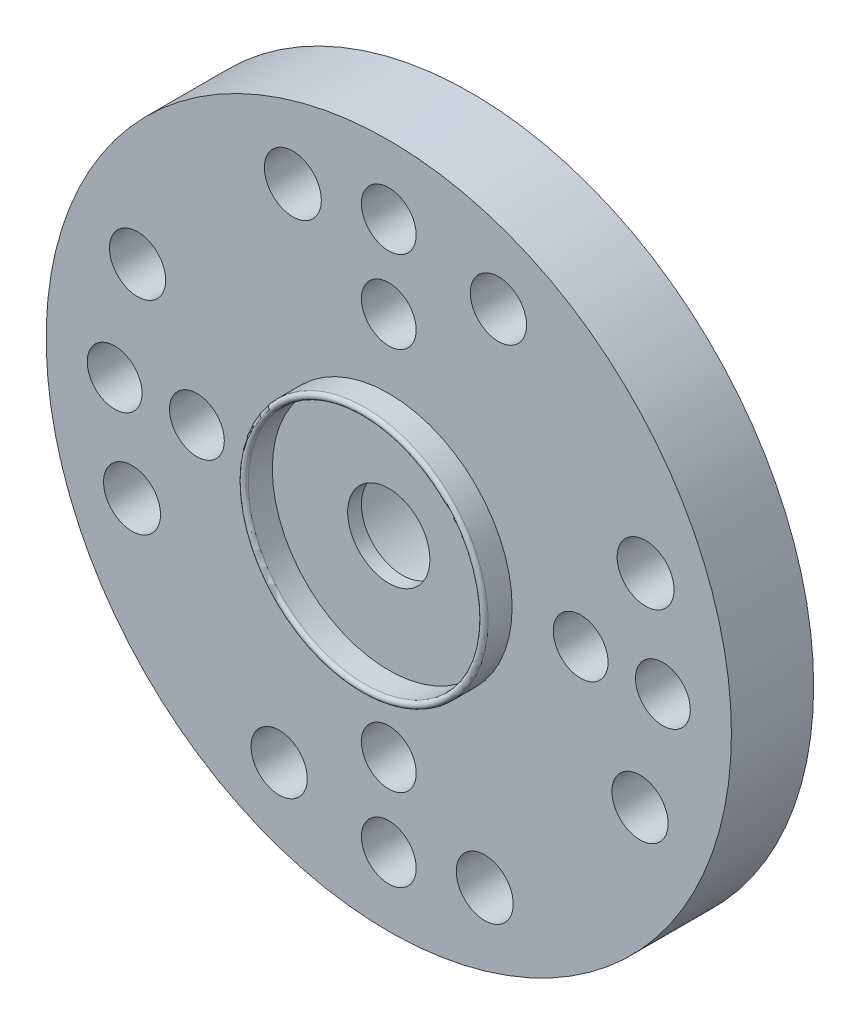
from build123d import *

# Parameters (mm, degrees)
ESQUISSE1_R             = 12.5
BOSS_EXTRU_2_DEPTH      = 3
ESQUISSE2_R             = 3
ENL_V_MAT_EXTRU_1_DEPTH = 2.5
ESQUISSE3_R             = 1.5
ENL_V_MAT_EXTRU_2_DEPTH = 4.5
BOSS_EXTRU_3_START      = 4
ESQUISSE5_R             = 4.5
ESQUISSE5_R_2           = 3
BOSS_EXTRU_3_DEPTH      = 4
ESQUISSE6_R             = 4.5
ESQUISSE6_R_2           = 4.25
BOSS_EXTRU_4_DEPTH      = 1
CONG_1_R                = 0.125
ESQUISSE7_R             = 1
ESQUISSE7_R_2           = 1.025837193
ESQUISSE7_R_3           = 1.039157515
ENL_V_MAT_EXTRU_3_DEPTH = 8


with BuildPart() as part:
    # Esquisse1 → Boss.-Extru.2 (new body)
    with BuildSketch(Plane.XY):
        Circle(ESQUISSE1_R)
    extrude(amount=BOSS_EXTRU_2_DEPTH)

    # Esquisse2 → Enlèv. mat.-Extru.1 (cut)
    with BuildSketch(Plane.XY):
        Circle(ESQUISSE2_R)
    extrude(amount=ENL_V_MAT_EXTRU_1_DEPTH, mode=Mode.SUBTRACT)

    # Esquisse3 → Enlèv. mat.-Extru.2 (cut)
    with BuildSketch(Plane(origin=(0, 0, 0), x_dir=(-1, 0, 0), z_dir=(0, 0, -1))):
        with Locations(Location((0, 0, 0), (0, 0, 180))):
            Circle(ESQUISSE3_R)
    extrude(amount=-ENL_V_MAT_EXTRU_2_DEPTH, mode=Mode.SUBTRACT)

    # Esquisse5 → Boss.-Extru.3 (add)
    with BuildSketch(Plane(origin=(0, 0, 0), x_dir=(-1, 0, 0), z_dir=(0, 0, -1)).offset(BOSS_EXTRU_3_START)):
        with Locations(Location((0, 0, 0), (0, 0, 180))):
            Circle(ESQUISSE5_R)
        Circle(ESQUISSE5_R_2, mode=Mode.SUBTRACT)
    extrude(amount=-BOSS_EXTRU_3_DEPTH)

    # Esquisse6 → Boss.-Extru.4 (add)
    with BuildSketch(Plane.XY.offset(3)):
        Circle(ESQUISSE6_R)
        Circle(ESQUISSE6_R_2, mode=Mode.SUBTRACT)
    extrude(amount=BOSS_EXTRU_4_DEPTH)

    # Congé1
    cong_1_edges = [part.edges().sort_by_distance(p)[0] for p in [
        (-4.5, 0, 4),
        (-4.25, 0, 4),
    ]]
    fillet(cong_1_edges, radius=CONG_1_R - 0.0001)  # a hair under: the kernel refuses the full size

    # Esquisse7 → Enlèv. mat.-Extru.3 (cut)
    with BuildSketch(Plane.XY.offset(3)):
        with Locations((0, 10)):
            Circle(ESQUISSE7_R)
        with Locations((0, 7)):
            Circle(ESQUISSE7_R)
        with Locations((4, 9.16515139)):
            Circle(ESQUISSE7_R_2)
        with Locations((-3.5, 9.367496998)):
            Circle(ESQUISSE7_R_3)
        with Locations((9.367496998, 3.5)):
            Circle(ESQUISSE7_R_3)
        with Locations((10, 0)):
            Circle(ESQUISSE7_R)
        with Locations((9.16515139, -4)):
            Circle(ESQUISSE7_R_2)
        with Locations((7, 0)):
            Circle(ESQUISSE7_R)
        with Locations((3.5, -9.367496998)):
            Circle(ESQUISSE7_R_3)
        with Locations((0, -10)):
            Circle(ESQUISSE7_R)
        with Locations((-4, -9.16515139)):
            Circle(ESQUISSE7_R_2)
        with Locations((0, -7)):
            Circle(ESQUISSE7_R)
        with Locations((-9.367496998, -3.5)):
            Circle(ESQUISSE7_R_3)
        with Locations((-10, 0)):
            Circle(ESQUISSE7_R)
        with Locations((-9.16515139, 4)):
            Circle(ESQUISSE7_R_2)
        with Locations((-7, 0)):
            Circle(ESQUISSE7_R)
    extrude(amount=-ENL_V_MAT_EXTRU_3_DEPTH, mode=Mode.SUBTRACT)


solid = part.part
